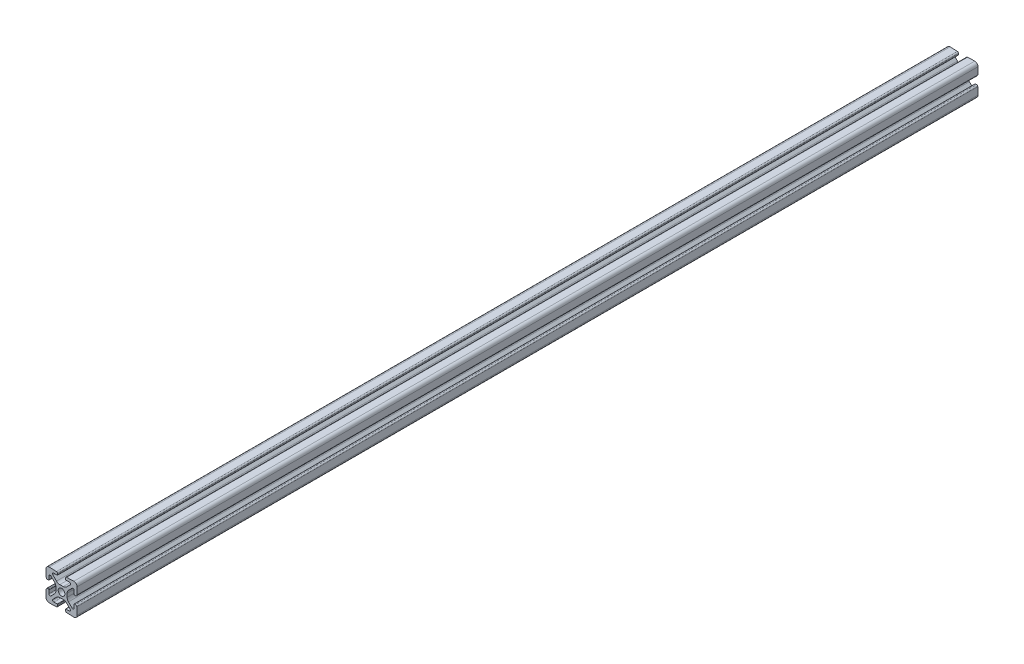
from build123d import *

# Parameters (mm, degrees)
BOSS_EXTRUDE1_DEPTH     = 304.8
CIRPATTERN1_COUNT       = 4
CUT_EXTRUDE1_DEPTH      = 306.611552742
CUT_EXTRUDE1_DEPTH_BACK = 306.611552742
SKETCH4_W               = 20.616616654
SKETCH4_H               = 34.076220988


with BuildPart() as part:
    # Sketch3 → Boss-Extrude1 (new, symmetric)
    with BuildSketch(Plane.XY):
        with BuildLine():
            Line((-2.524916986, 8.30911066), (-2.500487338, 9.008684239))
            ThreePointArc((-2.500487338, 9.008684239), (-2.714917039, 9.582202525), (-3.272080403, 9.836116498))
            Line((-3.272080403, 9.836116498), (-7.930201007, 9.998781654))
            ThreePointArc((-7.930201007, 9.998781654), (-9.414213562, 9.414213562), (-9.998781654, 7.930201007))
            Line((-9.998781654, 7.930201007), (-9.836116498, 3.272080403))
            ThreePointArc((-9.836116498, 3.272080403), (-9.582202525, 2.714917039), (-9.008684239, 2.500487338))
            Line((-9.008684239, 2.500487338), (-8.30911066, 2.524916986))
            ThreePointArc((-8.30911066, 2.524916986), (-8.100174399, 2.620134726), (-8.019763261, 2.835204083))
            Line((-8.019763261, 2.835204083), (-8.093719461, 4.953032548))
            ThreePointArc((-8.093719461, 4.953032548), (-7.631170264, 5.686128657), (-6.779559917, 5.52444538))
            Line((-6.779559917, 5.52444538), (-4.478679656, 3.22356512))
            ThreePointArc((-4.478679656, 3.22356512), (-3.828361402, 2.250295073), (-3.6, 1.102244776))
            Line((-3.6, 1.102244776), (-3.6, 0))
            Line((-3.6, 0), (-2.15, 0))
            ThreePointArc((-2.15, 0), (-1.52027958, 1.52027958), (0, 2.15))
            Line((0, 2.15), (0, 3.6))
            Line((0, 3.6), (-1.102244776, 3.6))
            ThreePointArc((-1.102244776, 3.6), (-2.250295073, 3.828361402), (-3.22356512, 4.478679656))
            Line((-3.22356512, 4.478679656), (-5.52444538, 6.779559917))
            ThreePointArc((-5.52444538, 6.779559917), (-5.686128657, 7.631170264), (-4.953032548, 8.093719461))
            Line((-4.953032548, 8.093719461), (-2.835204083, 8.019763261))
            ThreePointArc((-2.835204083, 8.019763261), (-2.620134726, 8.100174399), (-2.524916986, 8.30911066))
        make_face()
    boss_extrude1 = extrude(amount=BOSS_EXTRUDE1_DEPTH, both=True)

    # CirPattern1: Boss-Extrude1 ×4 about axis
    cirpattern1_axis = Axis((0, 0, 304.8), (0, 0, -1))
    for i in range(1, CIRPATTERN1_COUNT):
        add(boss_extrude1.rotate(cirpattern1_axis, i * 360 / CIRPATTERN1_COUNT))

    # Sketch4 → Cut-Extrude1 (cut, two sides: drawn at the far end of the back side and taken through both)
    with BuildSketch(Plane(origin=(0.339081089, 9.71001196, 0), x_dir=(0.9993908270190978, -0.034899496702443626, 0), z_dir=(0.034899496702443626, 0.9993908270190978, 0)).offset(-CUT_EXTRUDE1_DEPTH_BACK)):
        with Locations((-0.00156471, -292.238110494)):
            Rectangle(SKETCH4_W, SKETCH4_H)
    extrude(amount=CUT_EXTRUDE1_DEPTH + CUT_EXTRUDE1_DEPTH_BACK, mode=Mode.SUBTRACT)


solid = part.part
